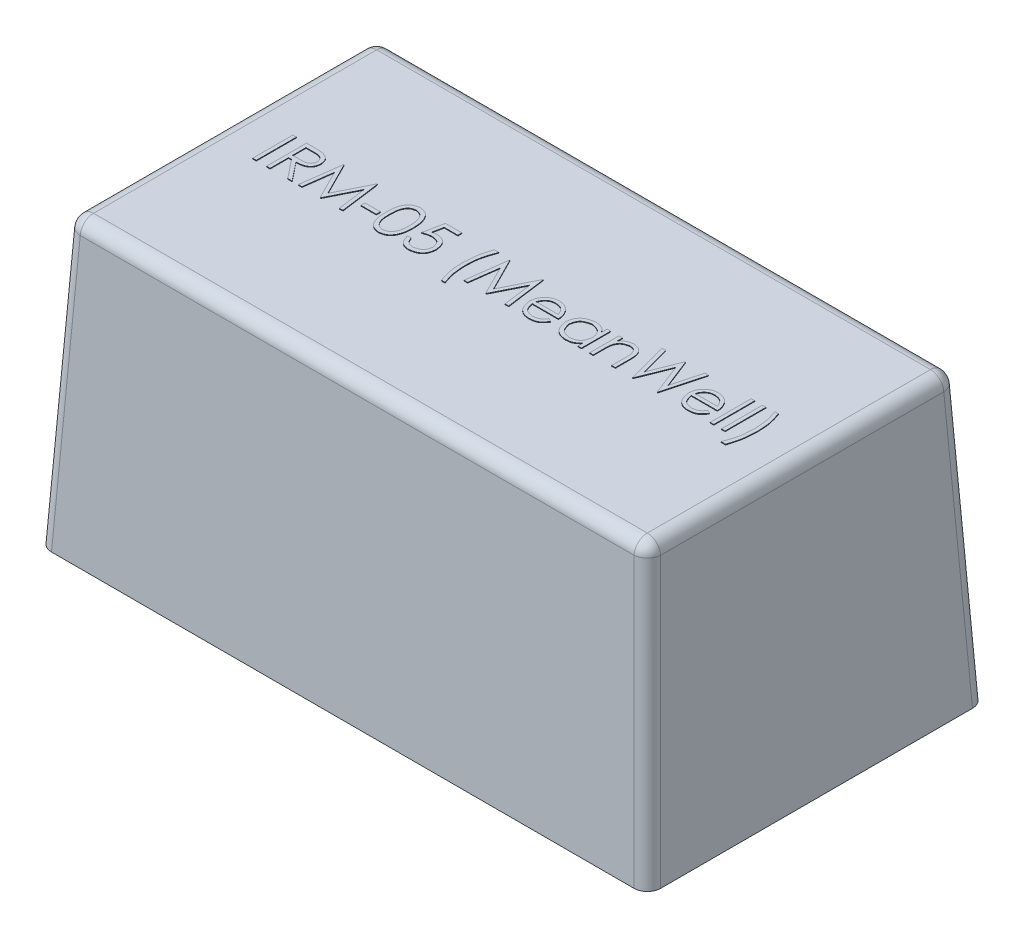
from build123d import *

# Parameters (mm, degrees)
SKIZZE1_W                       = 45.7
SKIZZE1_H                       = 25.4
AUFSATZ_LINEAR_AUSTRAGEN1_DEPTH = 21.5
FASE1_SIZE                      = 21.7
FASE1_SIZE_2                    = 1.13724881
VERRUNDUNG1_R                   = 1
VERRUNDUNG2_R                   = 1
SKIZZE2_R                       = 0.52
AUFSATZ_LINEAR_AUSTRAGEN2_DEPTH = 3.5
FASE2_SIZE                      = 0.5
WRAP_START                      = -1
WRAP_1_OUTLINE_W                = 0.269230769
WRAP_1_OUTLINE_H                = 3
WRAP_1_OUTLINE_H_2              = 3.076923077
WRAP_1_OUTLINE_W_2              = 0.26923077
WRAP_1_OUTLINE_W_3              = 1.153846154
WRAP_1_OUTLINE_H_3              = 0.307692308
WRAP_1_DEPTH                    = 1.05


with BuildPart() as part:
    # Skizze1 → Aufsatz-Linear austragen1 (new body)
    with BuildSketch(Plane(origin=(0, 0, 0), x_dir=(1, 0, 0), z_dir=(0, 1, 0))):
        with Locations((22.85, -12.7)):
            Rectangle(SKIZZE1_W, SKIZZE1_H)
    extrude(amount=AUFSATZ_LINEAR_AUSTRAGEN1_DEPTH)

    # Fase1
    # the kernel refuses this chamfer: 21.7, 1.13724881 mm, written as the material it takes off along each edge
    with BuildSketch(Plane(origin=(-56.417140399, 21.5, 0), x_dir=(0, -1, 0), z_dir=(1, 0, 0)), Plane(origin=(102.117140399, 21.5, 25.4), x_dir=(0, -1, 0), z_dir=(-1, 0, 0))) as fase1_piece_1:
        Polygon((FASE1_SIZE, 0), (0, -FASE1_SIZE_2), (0, 0), align=None)
    extrude(amount=158.534280798, mode=Mode.SUBTRACT)
    with BuildSketch(Plane(origin=(0, 21.5, 81.817140399), x_dir=(0, -1, 0), z_dir=(0, 0, -1)), Plane(origin=(45.7, 21.5, -56.417140399), x_dir=(0, -1, 0), z_dir=(0, 0, 1))) as fase1_piece_2:
        Polygon((FASE1_SIZE, 0), (0, -FASE1_SIZE_2), (0, 0), align=None)
    extrude(amount=138.234280798, mode=Mode.SUBTRACT)

    # Verrundung1
    verrundung1_edges = [part.edges().sort_by_distance(p)[0] for p in [
        (44.56275119, 21.5, 12.7),
        (22.85, 21.5, 24.26275119),
        (1.13724881, 21.5, 12.7),
        (22.85, 21.5, 1.13724881),
    ]]
    fillet(verrundung1_edges, radius=VERRUNDUNG1_R)

    # Verrundung2
    # the kernel refuses this fillet: 1 mm, written as the material it takes off along each edge
    with BuildSketch(Plane(origin=(2.086213377, 20.5, 2.086213377), x_dir=(0.036051683178571894, 0.6879070948203586, 0.7249028245467154), z_dir=(-0.5569624870263531, 0.6161051664211549, -0.5569624870263531))) as verrundung2_piece_1_section:
        Polygon((-2.008366798, -2.008366798), (2.008366798, -2.008366798), (2.008366798, 2.008366798), (-2.008366798, 2.008366798), align=None)
    verrundung2_piece_1 = extrude(amount=2.008366798, mode=Mode.PRIVATE)
    verrundung2_piece_1 = split(verrundung2_piece_1, bisect_by=Plane(origin=(2.086213377, 20.5, 2.086213377), z_dir=(0.05226442766851222, 0.9972646886363549, 0.05226442766851222)), keep=Keep.TOP, mode=Mode.PRIVATE)
    verrundung2_piece_1 = split(verrundung2_piece_1, bisect_by=Plane(origin=(2.086213377, 20.5, 2.086213377), z_dir=(-1, 0, 0)), keep=Keep.TOP, mode=Mode.PRIVATE)
    verrundung2_piece_1 = split(verrundung2_piece_1, bisect_by=Plane(origin=(2.086213377, 20.5, 2.086213377), z_dir=(0, 0, -1)), keep=Keep.TOP, mode=Mode.PRIVATE)
    verrundung2_piece_1 = split(verrundung2_piece_1, bisect_by=Plane(origin=(1.087583842, 20.552335956, 2.086213377), z_dir=(0.998629534755637, -0.052335956222659075, 0)), keep=Keep.TOP, mode=Mode.PRIVATE)
    verrundung2_piece_1 = split(verrundung2_piece_1, bisect_by=Plane(origin=(2.086213377, 20.552335956, 1.087583842), z_dir=(0, -0.052335956222659075, 0.998629534755637)), keep=Keep.TOP, mode=Mode.PRIVATE)
    verrundung2_piece_1 = split(verrundung2_piece_1, bisect_by=Plane(origin=(2.086213377, 21.5, 2.086213377), z_dir=(0, -1, 0)), keep=Keep.TOP, mode=Mode.PRIVATE)
    verrundung2_piece_1 = verrundung2_piece_1 - Plane(origin=(2.086213377, 20.5, 2.086213377), x_dir=(0.5569624870263531, -0.6161051664211549, 0.5569624870263531), z_dir=(0.036051683178571894, 0.6879070948203586, 0.7249028245467154)) * Sphere(VERRUNDUNG2_R, mode=Mode.PRIVATE)
    add(verrundung2_piece_1, mode=Mode.SUBTRACT)
    with BuildSketch(Plane(origin=(43.613786623, 20.5, 2.086213377), x_dir=(0.036051683178571894, -0.6879070948203586, -0.7249028245467154), z_dir=(0.5569624870263531, 0.6161051664211549, -0.5569624870263531))) as verrundung2_piece_2_section:
        Polygon((-2.008366798, -2.008366798), (2.008366798, -2.008366798), (2.008366798, 2.008366798), (-2.008366798, 2.008366798), align=None)
    verrundung2_piece_2 = extrude(amount=2.008366798, mode=Mode.PRIVATE)
    verrundung2_piece_2 = split(verrundung2_piece_2, bisect_by=Plane(origin=(43.613786623, 20.5, 2.086213377), z_dir=(-0.05226442766851222, 0.9972646886363549, 0.05226442766851222)), keep=Keep.TOP, mode=Mode.PRIVATE)
    verrundung2_piece_2 = split(verrundung2_piece_2, bisect_by=Plane(origin=(43.613786623, 20.5, 2.086213377), z_dir=(1, 0, 0)), keep=Keep.TOP, mode=Mode.PRIVATE)
    verrundung2_piece_2 = split(verrundung2_piece_2, bisect_by=Plane(origin=(43.613786623, 20.5, 2.086213377), z_dir=(0, 0, -1)), keep=Keep.TOP, mode=Mode.PRIVATE)
    verrundung2_piece_2 = split(verrundung2_piece_2, bisect_by=Plane(origin=(44.612416158, 20.552335956, 2.086213377), z_dir=(-0.998629534755637, -0.052335956222659075, 0)), keep=Keep.TOP, mode=Mode.PRIVATE)
    verrundung2_piece_2 = split(verrundung2_piece_2, bisect_by=Plane(origin=(43.613786623, 20.552335956, 1.087583842), z_dir=(0, -0.052335956222659075, 0.998629534755637)), keep=Keep.TOP, mode=Mode.PRIVATE)
    verrundung2_piece_2 = split(verrundung2_piece_2, bisect_by=Plane(origin=(43.613786623, 21.5, 2.086213377), z_dir=(0, -1, 0)), keep=Keep.TOP, mode=Mode.PRIVATE)
    verrundung2_piece_2 = verrundung2_piece_2 - Plane(origin=(43.613786623, 20.5, 2.086213377), x_dir=(-0.5569624870263531, -0.6161051664211549, 0.5569624870263531), z_dir=(0.036051683178571894, -0.6879070948203586, -0.7249028245467154)) * Sphere(VERRUNDUNG2_R, mode=Mode.PRIVATE)
    add(verrundung2_piece_2, mode=Mode.SUBTRACT)
    with BuildSketch(Plane(origin=(2.086213377, 20.5, 23.313786623), x_dir=(0.7249028245467154, 0.6879070948203586, -0.036051683178571894), z_dir=(-0.5569624870263531, 0.6161051664211549, 0.5569624870263531))) as verrundung2_piece_3_section:
        Polygon((-2.008366798, -2.008366798), (2.008366798, -2.008366798), (2.008366798, 2.008366798), (-2.008366798, 2.008366798), align=None)
    verrundung2_piece_3 = extrude(amount=2.008366798, mode=Mode.PRIVATE)
    verrundung2_piece_3 = split(verrundung2_piece_3, bisect_by=Plane(origin=(2.086213377, 20.5, 23.313786623), z_dir=(0.05226442766851222, 0.9972646886363549, -0.05226442766851222)), keep=Keep.TOP, mode=Mode.PRIVATE)
    verrundung2_piece_3 = split(verrundung2_piece_3, bisect_by=Plane(origin=(2.086213377, 20.5, 23.313786623), z_dir=(0, 0, 1)), keep=Keep.TOP, mode=Mode.PRIVATE)
    verrundung2_piece_3 = split(verrundung2_piece_3, bisect_by=Plane(origin=(2.086213377, 20.5, 23.313786623), z_dir=(-1, 0, 0)), keep=Keep.TOP, mode=Mode.PRIVATE)
    verrundung2_piece_3 = split(verrundung2_piece_3, bisect_by=Plane(origin=(2.086213377, 20.552335956, 24.312416158), z_dir=(0, -0.052335956222659075, -0.998629534755637)), keep=Keep.TOP, mode=Mode.PRIVATE)
    verrundung2_piece_3 = split(verrundung2_piece_3, bisect_by=Plane(origin=(1.087583842, 20.552335956, 23.313786623), z_dir=(0.998629534755637, -0.052335956222659075, 0)), keep=Keep.TOP, mode=Mode.PRIVATE)
    verrundung2_piece_3 = split(verrundung2_piece_3, bisect_by=Plane(origin=(2.086213377, 21.5, 23.313786623), z_dir=(0, -1, 0)), keep=Keep.TOP, mode=Mode.PRIVATE)
    verrundung2_piece_3 = verrundung2_piece_3 - Plane(origin=(2.086213377, 20.5, 23.313786623), x_dir=(0.5569624870263531, -0.6161051664211549, -0.5569624870263531), z_dir=(0.7249028245467154, 0.6879070948203586, -0.036051683178571894)) * Sphere(VERRUNDUNG2_R, mode=Mode.PRIVATE)
    add(verrundung2_piece_3, mode=Mode.SUBTRACT)
    with BuildSketch(Plane(origin=(43.613786623, 20.5, 23.313786623), x_dir=(0.7249028245467154, -0.6879070948203586, 0.036051683178571894), z_dir=(0.5569624870263531, 0.6161051664211549, 0.5569624870263531))) as verrundung2_piece_4_section:
        Polygon((-2.008366798, -2.008366798), (2.008366798, -2.008366798), (2.008366798, 2.008366798), (-2.008366798, 2.008366798), align=None)
    verrundung2_piece_4 = extrude(amount=2.008366798, mode=Mode.PRIVATE)
    verrundung2_piece_4 = split(verrundung2_piece_4, bisect_by=Plane(origin=(43.613786623, 20.5, 23.313786623), z_dir=(-0.05226442766851222, 0.9972646886363549, -0.05226442766851222)), keep=Keep.TOP, mode=Mode.PRIVATE)
    verrundung2_piece_4 = split(verrundung2_piece_4, bisect_by=Plane(origin=(43.613786623, 20.5, 23.313786623), z_dir=(0, 0, 1)), keep=Keep.TOP, mode=Mode.PRIVATE)
    verrundung2_piece_4 = split(verrundung2_piece_4, bisect_by=Plane(origin=(43.613786623, 20.5, 23.313786623), z_dir=(1, 0, 0)), keep=Keep.TOP, mode=Mode.PRIVATE)
    verrundung2_piece_4 = split(verrundung2_piece_4, bisect_by=Plane(origin=(43.613786623, 20.552335956, 24.312416158), z_dir=(0, -0.052335956222659075, -0.998629534755637)), keep=Keep.TOP, mode=Mode.PRIVATE)
    verrundung2_piece_4 = split(verrundung2_piece_4, bisect_by=Plane(origin=(44.612416158, 20.552335956, 23.313786623), z_dir=(-0.998629534755637, -0.052335956222659075, 0)), keep=Keep.TOP, mode=Mode.PRIVATE)
    verrundung2_piece_4 = split(verrundung2_piece_4, bisect_by=Plane(origin=(43.613786623, 21.5, 23.313786623), z_dir=(0, -1, 0)), keep=Keep.TOP, mode=Mode.PRIVATE)
    verrundung2_piece_4 = verrundung2_piece_4 - Plane(origin=(43.613786623, 20.5, 23.313786623), x_dir=(-0.5569624870263531, -0.6161051664211549, -0.5569624870263531), z_dir=(0.7249028245467154, -0.6879070948203586, 0.036051683178571894)) * Sphere(VERRUNDUNG2_R, mode=Mode.PRIVATE)
    add(verrundung2_piece_4, mode=Mode.SUBTRACT)
    with BuildSketch(Plane(origin=(1.090311669, 20.604385994, 24.309688331), x_dir=(0.9986332808396098, -0.05219280108687576, 0.0027353087984660165), z_dir=(-0.05226442766851222, -0.9972646886363549, 0.05226442766851222)), Plane(origin=(45.819822115, -2.486342148, 25.519822115), x_dir=(-0.9986332808396098, -0.05219280108687595, 0.0027353087984624638), z_dir=(-0.05226442766851222, 0.9972646886363549, -0.05226442766851222))) as verrundung2_piece_5:
        with BuildLine():
            CenterArc((VERRUNDUNG2_R * 0.997264688636, -VERRUNDUNG2_R), VERRUNDUNG2_R, 90, 89.843063666)
            Line((-VERRUNDUNG2_R * 0.00273156015282, -VERRUNDUNG2_R * 0.997260947686), (0, 0))
            Line((0, 0), (VERRUNDUNG2_R * 0.997264688636, 0))
        make_face()
    extrude(amount=23.15406171, mode=Mode.SUBTRACT)
    with BuildSketch(Plane(origin=(-0.119822115, -2.486342148, -0.119822115), x_dir=(-0.0027353087984660165, -0.05219280108687576, 0.9986332808396098), z_dir=(0.05226442766851222, 0.9972646886363549, 0.05226442766851222)), Plane(origin=(44.609688331, 20.604385994, 1.090311669), x_dir=(0.0027353087984660165, -0.05219280108687577, 0.9986332808396097), z_dir=(0.05226442766851222, -0.9972646886363549, -0.05226442766851222))) as verrundung2_piece_6:
        with BuildLine():
            CenterArc((VERRUNDUNG2_R * 0.997264688636, VERRUNDUNG2_R), VERRUNDUNG2_R, 180.156936334, 89.843063666)
            Line((-VERRUNDUNG2_R * 0.00273156015282, VERRUNDUNG2_R * 0.997260947686), (0, 0))
            Line((0, 0), (VERRUNDUNG2_R * 0.997264688636, 0))
        make_face()
    extrude(amount=23.15406171, mode=Mode.SUBTRACT)

    # Skizze2 → Aufsatz-Linear austragen2 (add)
    with BuildSketch(Plane.XZ):
        with Locations(Location((42.089518444, 3.45, 0), (0, 0, 90))):
            Circle(SKIZZE2_R)
        with Locations(Location((42.089518444, 14.2, 0), (0, 0, 90))):
            Circle(SKIZZE2_R)
        with Locations(Location((3.589518444, 3.45, 0), (0, 0, 90))):
            Circle(SKIZZE2_R)
        with Locations(Location((3.589518444, 11.45, 0), (0, 0, 90))):
            Circle(SKIZZE2_R)
    extrude(amount=AUFSATZ_LINEAR_AUSTRAGEN2_DEPTH)

    # Fase2
    fase2_edges = [part.edges().sort_by_distance(p)[0] for p in [
        (42.089518444, -3.5, 2.93),
        (42.089518444, -3.5, 13.68),
        (3.589518444, -3.5, 2.93),
        (3.589518444, -3.5, 10.93),
    ]]
    chamfer(fase2_edges, length=FASE2_SIZE)

    # Перенос1: read off the stored shape, not the designer's step
    # Перенос1 outline → Перенос1 (add)
    # profile 1 of 16: a face of its own
    with BuildSketch(Plane(origin=(0, 21.5, 0), x_dir=(1, 0, 0), z_dir=(0, 1, 0)).offset(WRAP_START)):
        with BuildLine():
            Line((7.488737364, -13.822017498), (6.386573903, -12.437402113))
            add(Edge.make_bspline(
                [(6.386573903, -12.437402113), (6.613405611, -12.42842299), (6.983870512, -12.413758152), (7.395589942, -12.053417943), (7.432032264, -11.767457266), (7.450275826, -11.624301152)],
                knots=[0, 0, 0, 0, 0.440919364, 0.720116024, 1, 1, 1, 1], degree=3))
            add(Edge.make_bspline(
                [(7.450275826, -11.624301152), (7.427387007, -11.463914345), (7.375626804, -11.101219631), (7.035453937, -10.948223033), (6.845708518, -10.862882883)],
                knots=[0, 0, 0, 0, 0.442208835, 1, 1, 1, 1], degree=3))
            add(Edge.make_bspline(
                [(6.845708518, -10.862882883), (6.746523027, -10.85005188), (6.520978605, -10.820874617), (6.293476642, -10.82160712), (6.166021018, -10.822017498)],
                knots=[0, 0, 0, 0, 0.439760335, 1, 1, 1, 1], degree=3))
            Line((6.166021018, -10.822017498), (5.565660441, -10.822017498))
            Line((5.565660441, -10.822017498), (5.565660441, -13.822017498))
            Line((5.565660441, -13.822017498), (5.83489121, -13.822017498))
            Line((5.83489121, -13.822017498), (5.83489121, -12.437402113))
            Line((5.83489121, -12.437402113), (6.05364121, -12.437402113))
            Line((6.05364121, -12.437402113), (7.155804672, -13.822017498))
            Line((7.155804672, -13.822017498), (7.488737364, -13.822017498))
        make_face()
        with BuildLine():
            Line((5.83489121, -11.129709806), (6.39739121, -11.129709806))
            add(Edge.make_bspline(
                [(6.39739121, -11.129709806), (6.577424202, -11.126254917), (6.847092878, -11.121079893), (7.135941686, -11.361160469), (7.166020269, -11.536243234), (7.181045056, -11.62370019)],
                knots=[0, 0, 0, 0, 0.501300847, 0.7508909, 1, 1, 1, 1], degree=3))
            add(Edge.make_bspline(
                [(7.181045056, -11.62370019), (7.166915768, -11.713555527), (7.138658254, -11.893259448), (6.841549979, -12.136214373), (6.56728911, -12.134836511), (6.384170056, -12.133916536)],
                knots=[0, 0, 0, 0, 0.249442492, 0.498866239, 1, 1, 1, 1], degree=3))
            Line((6.384170056, -12.133916536), (5.83489121, -12.129709806))
            Line((5.83489121, -12.129709806), (5.83489121, -11.129709806))
        make_face(mode=Mode.SUBTRACT)
    # profile 2 of 16: a face of its own
    with BuildSketch(Plane(origin=(0, 21.5, 0), x_dir=(1, 0, 0), z_dir=(0, 1, 0)).offset(WRAP_START)):
        with BuildLine():
            add(Edge.make_bspline(
                [(14.03020371, -10.745094421), (13.854574445, -10.77607514), (13.502635397, -10.838156621), (13.165397112, -11.286221213), (13.039672279, -11.79727875), (13.031361611, -12.147698582), (13.027198903, -12.323219421)],
                knots=[0, 0, 0, 0, 0.24817273, 0.497307066, 0.7482075, 1, 1, 1, 1], degree=3))
            add(Edge.make_bspline(
                [(13.027198903, -12.323219421), (13.031570647, -12.498545057), (13.040298697, -12.84857719), (13.168241028, -13.357836046), (13.502528252, -13.807350136), (13.854536795, -13.868449466), (14.03020371, -13.898940575)],
                knots=[0, 0, 0, 0, 0.251778203, 0.502667285, 0.751810273, 1, 1, 1, 1], degree=3))
            add(Edge.make_bspline(
                [(14.03020371, -13.898940575), (14.206994907, -13.868244146), (14.561210294, -13.806741382), (14.904772978, -13.362009947), (15.051194112, -12.852878617), (15.060832779, -12.499975781), (15.065660441, -12.323219421)],
                knots=[0, 0, 0, 0, 0.248282854, 0.497454672, 0.74829309, 1, 1, 1, 1], degree=3))
            add(Edge.make_bspline(
                [(15.065660441, -12.323219421), (15.060715348, -12.14626212), (15.050841573, -11.792934782), (14.90409689, -11.283674408), (14.562396623, -10.836287597), (14.207364452, -10.775451553), (14.03020371, -10.745094421)],
                knots=[0, 0, 0, 0, 0.251688421, 0.502541567, 0.751768679, 1, 1, 1, 1], degree=3))
        make_face()
        with BuildLine():
            add(Edge.make_bspline(
                [(13.296429672, -12.322017498), (13.299309477, -12.044885222), (13.303621475, -11.629928702), (13.62766301, -11.139777668), (13.902256834, -11.081736416), (14.039218133, -11.052786729)],
                knots=[0, 0, 0, 0, 0.501952468, 0.751584954, 1, 1, 1, 1], degree=3))
            add(Edge.make_bspline(
                [(14.039218133, -11.052786729), (14.176214005, -11.082241506), (14.45097018, -11.141315417), (14.767437132, -11.634647317), (14.784822566, -12.046830217), (14.796429672, -12.322017498)],
                knots=[0, 0, 0, 0, 0.248415166, 0.49821648, 1, 1, 1, 1], degree=3))
            add(Edge.make_bspline(
                [(14.796429672, -12.322017498), (14.794266062, -12.434772352), (14.789353247, -12.690799928), (14.721063052, -12.937930346), (14.682847941, -13.076224229)],
                knots=[0, 0, 0, 0, 0.440401208, 1, 1, 1, 1], degree=3))
            add(Edge.make_bspline(
                [(14.682847941, -13.076224229), (14.62815456, -13.199386906), (14.504906186, -13.476926883), (14.205665896, -13.55038714), (14.039218133, -13.591248267)],
                knots=[0, 0, 0, 0, 0.443765538, 1, 1, 1, 1], degree=3))
            add(Edge.make_bspline(
                [(14.039218133, -13.591248267), (13.902366267, -13.562051944), (13.628032145, -13.503524808), (13.303160954, -13.01426793), (13.299125096, -12.599217056), (13.296429672, -12.322017498)],
                knots=[0, 0, 0, 0, 0.248463989, 0.498072495, 1, 1, 1, 1], degree=3))
        make_face(mode=Mode.SUBTRACT)
    # profile 3 of 16: a face of its own
    with BuildSketch(Plane(origin=(0, 21.5, 0), x_dir=(1, 0, 0), z_dir=(0, 1, 0)).offset(WRAP_START)):
        with BuildLine():
            add(Edge.make_bspline(
                [(16.342102749, -12.168171344), (16.514067607, -12.189179717), (16.899542487, -12.236271898), (17.006447182, -12.618641124), (17.065660441, -12.83043096)],
                knots=[0, 0, 0, 0, 0.446111712, 1, 1, 1, 1], degree=3))
            add(Edge.make_bspline(
                [(17.065660441, -12.83043096), (17.030336171, -13.012721162), (16.950550598, -13.424453051), (16.535521347, -13.531561191), (16.304242172, -13.591248267)],
                knots=[0, 0, 0, 0, 0.442740062, 1, 1, 1, 1], degree=3))
            add(Edge.make_bspline(
                [(16.304242172, -13.591248267), (16.162602956, -13.570040407), (15.843656729, -13.522284093), (15.714425246, -13.220534096), (15.642583518, -13.052786729)],
                knots=[0, 0, 0, 0, 0.444084941, 1, 1, 1, 1], degree=3))
            Line((15.642583518, -13.052786729), (15.373352749, -13.052786729))
            add(Edge.make_bspline(
                [(15.373352749, -13.052786729), (15.429160305, -13.248471129), (15.520731645, -13.569558167), (15.905118012, -13.858840425), (16.160749076, -13.885570194), (16.288617172, -13.898940575)],
                knots=[0, 0, 0, 0, 0.438171803, 0.718970375, 1, 1, 1, 1], degree=3))
            add(Edge.make_bspline(
                [(16.288617172, -13.898940575), (16.53510865, -13.856111029), (16.940370777, -13.785694018), (17.281917991, -13.305211825), (17.317223847, -12.996387606), (17.33489121, -12.841849229)],
                knots=[0, 0, 0, 0, 0.43681497, 0.718177218, 1, 1, 1, 1], degree=3))
            add(Edge.make_bspline(
                [(17.33489121, -12.841849229), (17.298094972, -12.617206779), (17.237648445, -12.248178402), (16.818046059, -11.906574924), (16.533262001, -11.875850758), (16.390780633, -11.860479036)],
                knots=[0, 0, 0, 0, 0.437391695, 0.718519354, 1, 1, 1, 1], degree=3))
            add(Edge.make_bspline(
                [(16.390780633, -11.860479036), (16.338034762, -11.86308532), (16.218140293, -11.869009555), (16.102295672, -11.900907442), (16.037415249, -11.918772306)],
                knots=[0, 0, 0, 0, 0.439935812, 1, 1, 1, 1], degree=3))
            Line((16.037415249, -11.918772306), (16.199073903, -11.129709806))
            Line((16.199073903, -11.129709806), (17.219506595, -11.129709806))
            Line((17.219506595, -11.129709806), (17.219506595, -10.822017498))
            Line((17.219506595, -10.822017498), (15.988737364, -10.822017498))
            Line((15.988737364, -10.822017498), (15.681045056, -12.322017498))
            add(Edge.make_bspline(
                [(15.681045056, -12.322017498), (15.774904172, -12.28619293), (15.987937666, -12.204881349), (16.215051564, -12.181340484), (16.342102749, -12.168171344)],
                knots=[0, 0, 0, 0, 0.440583842, 1, 1, 1, 1], degree=3))
        make_face()
    # profile 4 of 16: a face of its own
    with BuildSketch(Plane(origin=(0, 21.5, 0), x_dir=(1, 0, 0), z_dir=(0, 1, 0)).offset(WRAP_START)):
        with BuildLine():
            add(Edge.make_bspline(
                [(19.796429672, -14.668171344), (19.703047654, -14.398150182), (19.490790402, -13.784392301), (19.464820396, -13.134377377), (19.450275826, -12.770334806)],
                knots=[0, 0, 0, 0, 0.439947364, 1, 1, 1, 1], degree=3))
            add(Edge.make_bspline(
                [(19.450275826, -12.770334806), (19.46260633, -12.457812972), (19.490603542, -11.748211811), (19.736021514, -11.080353631), (19.873352749, -10.706632883)],
                knots=[0, 0, 0, 0, 0.440419, 1, 1, 1, 1], degree=3))
            Line((19.873352749, -10.706632883), (19.527198903, -10.706632883))
            add(Edge.make_bspline(
                [(19.527198903, -10.706632883), (19.434391576, -11.007581048), (19.223470798, -11.691538057), (19.196274629, -12.40773402), (19.181045056, -12.808796344)],
                knots=[0, 0, 0, 0, 0.440010353, 1, 1, 1, 1], degree=3))
            add(Edge.make_bspline(
                [(19.181045056, -12.808796344), (19.190170568, -13.089032837), (19.210890049, -13.725309982), (19.413708234, -14.329875513), (19.527198903, -14.668171344)],
                knots=[0, 0, 0, 0, 0.440431493, 1, 1, 1, 1], degree=3))
            Line((19.527198903, -14.668171344), (19.796429672, -14.668171344))
        make_face()
    # profile 5 of 16: a face of its own
    with BuildSketch(Plane(origin=(0, 21.5, 0), x_dir=(1, 0, 0), z_dir=(0, 1, 0)).offset(WRAP_START)):
        with BuildLine():
            add(Edge.make_bspline(
                [(26.411814287, -12.78355596), (26.405452756, -12.663288777), (26.39103089, -12.390637868), (26.251317773, -12.154638146), (26.173232556, -12.022738652)],
                knots=[0, 0, 0, 0, 0.441103179, 1, 1, 1, 1], degree=3))
            add(Edge.make_bspline(
                [(26.173232556, -12.022738652), (26.069377575, -11.909926959), (25.833922121, -11.654165242), (25.48528172, -11.613805875), (25.290420056, -11.591248267)],
                knots=[0, 0, 0, 0, 0.44108123, 1, 1, 1, 1], degree=3))
            add(Edge.make_bspline(
                [(25.290420056, -11.591248267), (25.143003869, -11.603196971), (24.809046861, -11.630265596), (24.568059169, -11.867428364), (24.433448903, -11.999902113)],
                knots=[0, 0, 0, 0, 0.441422652, 1, 1, 1, 1], degree=3))
            add(Edge.make_bspline(
                [(24.433448903, -11.999902113), (24.367621142, -12.096814414), (24.218207126, -12.316783252), (24.194376535, -12.582964342), (24.181045056, -12.731873267)],
                knots=[0, 0, 0, 0, 0.440572864, 1, 1, 1, 1], degree=3))
            add(Edge.make_bspline(
                [(24.181045056, -12.731873267), (24.229888351, -12.989113992), (24.310045451, -13.411273694), (24.787398571, -13.814799846), (25.118159315, -13.845236089), (25.283809479, -13.860479036)],
                knots=[0, 0, 0, 0, 0.437768897, 0.718425852, 1, 1, 1, 1], degree=3))
            add(Edge.make_bspline(
                [(25.283809479, -13.860479036), (25.471750097, -13.84172306), (25.897150694, -13.799269205), (26.153393894, -13.450175818), (26.296429672, -13.255310767)],
                knots=[0, 0, 0, 0, 0.441796788, 1, 1, 1, 1], degree=3))
            Line((26.296429672, -13.255310767), (26.057246979, -13.129709806))
            add(Edge.make_bspline(
                [(26.057246979, -13.129709806), (25.970063918, -13.248836566), (25.772565927, -13.518697425), (25.437378622, -13.565247276), (25.250155633, -13.591248267)],
                knots=[0, 0, 0, 0, 0.44143771, 1, 1, 1, 1], degree=3))
            add(Edge.make_bspline(
                [(25.250155633, -13.591248267), (25.057185222, -13.553966509), (24.621163096, -13.469727318), (24.511439195, -13.029147993), (24.450275826, -12.78355596)],
                knots=[0, 0, 0, 0, 0.442570228, 1, 1, 1, 1], degree=3))
            Line((24.450275826, -12.78355596), (26.411814287, -12.78355596))
        make_face()
        with BuildLine():
            Line((26.142583518, -12.51432519), (24.478521018, -12.51432519))
            add(Edge.make_bspline(
                [(24.478521018, -12.51432519), (24.502488526, -12.440331319), (24.556811405, -12.272622601), (24.673906266, -12.140074911), (24.739338326, -12.066007883)],
                knots=[0, 0, 0, 0, 0.441204682, 1, 1, 1, 1], degree=3))
            add(Edge.make_bspline(
                [(24.739338326, -12.066007883), (24.812928872, -12.011772513), (24.97997442, -11.888661904), (25.187910581, -11.870589687), (25.304242172, -11.860479036)],
                knots=[0, 0, 0, 0, 0.440541801, 1, 1, 1, 1], degree=3))
            add(Edge.make_bspline(
                [(25.304242172, -11.860479036), (25.479926761, -11.885045558), (25.875834114, -11.940406513), (26.047239548, -12.309190018), (26.142583518, -12.51432519)],
                knots=[0, 0, 0, 0, 0.443751771, 1, 1, 1, 1], degree=3))
        make_face(mode=Mode.SUBTRACT)
    # profile 6 of 16: a face of its own
    with BuildSketch(Plane(origin=(0, 21.5, 0), x_dir=(1, 0, 0), z_dir=(0, 1, 0)).offset(WRAP_START)):
        with BuildLine():
            add(Edge.make_bspline(
                [(28.024795056, -11.591248267), (27.764112971, -11.643618003), (27.335360804, -11.729752184), (26.936923932, -12.219706299), (26.894533894, -12.55321089), (26.873352749, -12.719854036)],
                knots=[0, 0, 0, 0, 0.436944434, 0.718656493, 1, 1, 1, 1], degree=3))
            add(Edge.make_bspline(
                [(26.873352749, -12.719854036), (26.926960976, -12.981361877), (27.015169719, -13.411655497), (27.515020577, -13.800271646), (27.84929835, -13.840414361), (28.016381595, -13.860479036)],
                knots=[0, 0, 0, 0, 0.436598036, 0.718392797, 1, 1, 1, 1], degree=3))
            add(Edge.make_bspline(
                [(28.016381595, -13.860479036), (28.169208625, -13.847810507), (28.515569237, -13.819099096), (28.769774004, -13.577697249), (28.911814287, -13.442810767)],
                knots=[0, 0, 0, 0, 0.441236747, 1, 1, 1, 1], degree=3))
            Line((28.911814287, -13.442810767), (28.911814287, -13.822017498))
            Line((28.911814287, -13.822017498), (29.181045056, -13.822017498))
            Line((29.181045056, -13.822017498), (29.181045056, -11.629709806))
            Line((29.181045056, -11.629709806), (28.911814287, -11.629709806))
            Line((28.911814287, -11.629709806), (28.911814287, -12.035358844))
            add(Edge.make_bspline(
                [(28.911814287, -12.035358844), (28.809223035, -11.918570584), (28.576557027, -11.653707275), (28.22265069, -11.613645365), (28.024795056, -11.591248267)],
                knots=[0, 0, 0, 0, 0.440937859, 1, 1, 1, 1], degree=3))
        make_face()
        with BuildLine():
            add(Edge.make_bspline(
                [(28.028400826, -11.860479036), (28.230646291, -11.898677884), (28.563176996, -11.961484186), (28.868036639, -12.343720914), (28.897219823, -12.601670948), (28.911814287, -12.730671344)],
                knots=[0, 0, 0, 0, 0.436940555, 0.718414878, 1, 1, 1, 1], degree=3))
            add(Edge.make_bspline(
                [(28.911814287, -12.730671344), (28.872370142, -12.933373778), (28.807478254, -13.26685149), (28.408484739, -13.544328298), (28.153532053, -13.575603475), (28.025996979, -13.591248267)],
                knots=[0, 0, 0, 0, 0.436507279, 0.718123835, 1, 1, 1, 1], degree=3))
            add(Edge.make_bspline(
                [(28.025996979, -13.591248267), (27.817326194, -13.550334025), (27.346433578, -13.458005745), (27.215497012, -12.985807647), (27.142583518, -12.722858844)],
                knots=[0, 0, 0, 0, 0.443138792, 1, 1, 1, 1], degree=3))
            add(Edge.make_bspline(
                [(27.142583518, -12.722858844), (27.186846977, -12.514807748), (27.286806057, -12.044971087), (27.763046933, -11.926493099), (28.028400826, -11.860479036)],
                knots=[0, 0, 0, 0, 0.4428158, 1, 1, 1, 1], degree=3))
        make_face(mode=Mode.SUBTRACT)
    # profile 7 of 16: a face of its own
    with BuildSketch(Plane(origin=(0, 21.5, 0), x_dir=(1, 0, 0), z_dir=(0, 1, 0)).offset(WRAP_START)):
        with BuildLine():
            add(Edge.make_bspline(
                [(30.065660441, -13.029349229), (30.065555755, -12.942589756), (30.065318017, -12.745562471), (30.092124395, -12.550292308), (30.107126787, -12.441007883)],
                knots=[0, 0, 0, 0, 0.440342428, 1, 1, 1, 1], degree=3))
            add(Edge.make_bspline(
                [(30.107126787, -12.441007883), (30.170600436, -12.300062971), (30.314019158, -11.981597919), (30.660039775, -11.903829204), (30.852920056, -11.860479036)],
                knots=[0, 0, 0, 0, 0.442575755, 1, 1, 1, 1], degree=3))
            add(Edge.make_bspline(
                [(30.852920056, -11.860479036), (30.973156039, -11.871838582), (31.243956253, -11.897422998), (31.356082793, -12.150987951), (31.418424864, -12.291969421)],
                knots=[0, 0, 0, 0, 0.444002539, 1, 1, 1, 1], degree=3))
            add(Edge.make_bspline(
                [(31.418424864, -12.291969421), (31.428646919, -12.364696806), (31.451892309, -12.530081997), (31.450856271, -12.697160825), (31.450275826, -12.790767498)],
                knots=[0, 0, 0, 0, 0.439745452, 1, 1, 1, 1], degree=3))
            Line((31.450275826, -12.790767498), (31.450275826, -13.822017498))
            Line((31.450275826, -13.822017498), (31.719506595, -13.822017498))
            Line((31.719506595, -13.822017498), (31.719506595, -12.702426152))
            add(Edge.make_bspline(
                [(31.719506595, -12.702426152), (31.718175328, -12.466117492), (31.716002155, -12.080364958), (31.342653797, -11.652445772), (31.047513029, -11.611661032), (30.899795056, -11.591248267)],
                knots=[0, 0, 0, 0, 0.44128961, 0.720365415, 1, 1, 1, 1], degree=3))
            add(Edge.make_bspline(
                [(30.899795056, -11.591248267), (30.753722458, -11.606373634), (30.422386442, -11.640682456), (30.193589885, -11.887267044), (30.065660441, -12.025142498)],
                knots=[0, 0, 0, 0, 0.440859402, 1, 1, 1, 1], degree=3))
            Line((30.065660441, -12.025142498), (30.065660441, -11.629709806))
            Line((30.065660441, -11.629709806), (29.796429672, -11.629709806))
            Line((29.796429672, -11.629709806), (29.796429672, -13.822017498))
            Line((29.796429672, -13.822017498), (30.065660441, -13.822017498))
            Line((30.065660441, -13.822017498), (30.065660441, -13.029349229))
        make_face()
    # profile 8 of 16: a face of its own
    with BuildSketch(Plane(origin=(0, 21.5, 0), x_dir=(1, 0, 0), z_dir=(0, 1, 0)).offset(WRAP_START)):
        with BuildLine():
            add(Edge.make_bspline(
                [(38.33489121, -12.78355596), (38.328529679, -12.663288777), (38.314107813, -12.390637868), (38.174394696, -12.154638146), (38.096309479, -12.022738652)],
                knots=[0, 0, 0, 0, 0.441103179, 1, 1, 1, 1], degree=3))
            add(Edge.make_bspline(
                [(38.096309479, -12.022738652), (37.992454498, -11.909926959), (37.756999044, -11.654165242), (37.408358644, -11.613805875), (37.213496979, -11.591248267)],
                knots=[0, 0, 0, 0, 0.44108123, 1, 1, 1, 1], degree=3))
            add(Edge.make_bspline(
                [(37.213496979, -11.591248267), (37.066080792, -11.603196971), (36.732123784, -11.630265596), (36.491136092, -11.867428364), (36.356525826, -11.999902113)],
                knots=[0, 0, 0, 0, 0.441422652, 1, 1, 1, 1], degree=3))
            add(Edge.make_bspline(
                [(36.356525826, -11.999902113), (36.290698065, -12.096814414), (36.141284049, -12.316783252), (36.117453458, -12.582964342), (36.104121979, -12.731873267)],
                knots=[0, 0, 0, 0, 0.440572864, 1, 1, 1, 1], degree=3))
            add(Edge.make_bspline(
                [(36.104121979, -12.731873267), (36.152965274, -12.989113992), (36.233122374, -13.411273694), (36.710475494, -13.814799846), (37.041236238, -13.845236089), (37.206886403, -13.860479036)],
                knots=[0, 0, 0, 0, 0.437768897, 0.718425852, 1, 1, 1, 1], degree=3))
            add(Edge.make_bspline(
                [(37.206886403, -13.860479036), (37.39482702, -13.84172306), (37.820227617, -13.799269205), (38.076470817, -13.450175818), (38.219506595, -13.255310767)],
                knots=[0, 0, 0, 0, 0.441796788, 1, 1, 1, 1], degree=3))
            Line((38.219506595, -13.255310767), (37.980323903, -13.129709806))
            add(Edge.make_bspline(
                [(37.980323903, -13.129709806), (37.893140841, -13.248836566), (37.69564285, -13.518697425), (37.360455545, -13.565247276), (37.173232556, -13.591248267)],
                knots=[0, 0, 0, 0, 0.44143771, 1, 1, 1, 1], degree=3))
            add(Edge.make_bspline(
                [(37.173232556, -13.591248267), (36.980262145, -13.553966509), (36.544240019, -13.469727318), (36.434516118, -13.029147993), (36.373352749, -12.78355596)],
                knots=[0, 0, 0, 0, 0.442570228, 1, 1, 1, 1], degree=3))
            Line((36.373352749, -12.78355596), (38.33489121, -12.78355596))
        make_face()
        with BuildLine():
            Line((38.065660441, -12.51432519), (36.401597941, -12.51432519))
            add(Edge.make_bspline(
                [(36.401597941, -12.51432519), (36.425565449, -12.440331319), (36.479888328, -12.272622601), (36.596983189, -12.140074911), (36.662415249, -12.066007883)],
                knots=[0, 0, 0, 0, 0.441204682, 1, 1, 1, 1], degree=3))
            add(Edge.make_bspline(
                [(36.662415249, -12.066007883), (36.736005795, -12.011772513), (36.903051343, -11.888661904), (37.110987504, -11.870589687), (37.227319095, -11.860479036)],
                knots=[0, 0, 0, 0, 0.440541801, 1, 1, 1, 1], degree=3))
            add(Edge.make_bspline(
                [(37.227319095, -11.860479036), (37.403003684, -11.885045558), (37.798911037, -11.940406513), (37.970316472, -12.309190018), (38.065660441, -12.51432519)],
                knots=[0, 0, 0, 0, 0.443751771, 1, 1, 1, 1], degree=3))
        make_face(mode=Mode.SUBTRACT)
    # profile 9 of 16: a face of its own
    with BuildSketch(Plane(origin=(0, 21.5, 0), x_dir=(1, 0, 0), z_dir=(0, 1, 0)).offset(WRAP_START)):
        with BuildLine():
            add(Edge.make_bspline(
                [(40.565660441, -10.706632883), (40.658757311, -10.976710941), (40.870367927, -11.590602513), (40.896935157, -12.240493966), (40.911814287, -12.604469421)],
                knots=[0, 0, 0, 0, 0.439944235, 1, 1, 1, 1], degree=3))
            add(Edge.make_bspline(
                [(40.911814287, -12.604469421), (40.899860196, -12.917087909), (40.872720143, -13.626843418), (40.626504828, -14.294557954), (40.488737364, -14.668171344)],
                knots=[0, 0, 0, 0, 0.440459402, 1, 1, 1, 1], degree=3))
            Line((40.488737364, -14.668171344), (40.83489121, -14.668171344))
            add(Edge.make_bspline(
                [(40.83489121, -14.668171344), (40.927289675, -14.367506192), (41.137280062, -13.684196232), (41.165334776, -12.968943871), (41.181045056, -12.568411729)],
                knots=[0, 0, 0, 0, 0.440012835, 1, 1, 1, 1], degree=3))
            add(Edge.make_bspline(
                [(41.181045056, -12.568411729), (41.172099607, -12.287771988), (41.151791128, -11.650647346), (40.948587819, -11.045324177), (40.83489121, -10.706632883)],
                knots=[0, 0, 0, 0, 0.440478554, 1, 1, 1, 1], degree=3))
            Line((40.83489121, -10.706632883), (40.565660441, -10.706632883))
        make_face()
    # profile 10 of 16: a face of its own
    with BuildSketch(Plane(origin=(0, 21.5, 0), x_dir=(1, 0, 0), z_dir=(0, 1, 0)).offset(WRAP_START)):
        with Locations((4.661814288, -12.322017498)):
            Rectangle(WRAP_1_OUTLINE_W, WRAP_1_OUTLINE_H)
    # profile 11 of 16: a face of its own
    with BuildSketch(Plane(origin=(0, 21.5, 0), x_dir=(1, 0, 0), z_dir=(0, 1, 0)).offset(WRAP_START)):
        Polygon((10.738737364, -11.663363652), (11.025996979, -13.822017498), (11.296429672, -13.822017498), (10.897992172, -10.822017498), (10.858929672, -10.822017498), (9.623352749, -13.28355596), (8.384771018, -10.822017498), (8.346309479, -10.822017498), (7.950275826, -13.822017498), (8.221309479, -13.822017498), (8.507968133, -11.65855596), (9.595107556, -13.822017498), (9.655804672, -13.822017498), align=None)
    # profile 12 of 16: a face of its own
    with BuildSketch(Plane(origin=(0, 21.5, 0), x_dir=(1, 0, 0), z_dir=(0, 1, 0)).offset(WRAP_START)):
        Polygon((23.161814287, -11.663363652), (23.449073903, -13.822017498), (23.719506595, -13.822017498), (23.321069095, -10.822017498), (23.282006595, -10.822017498), (22.046429672, -13.28355596), (20.807847941, -10.822017498), (20.769386403, -10.822017498), (20.373352749, -13.822017498), (20.644386403, -13.822017498), (20.931045056, -11.65855596), (22.018184479, -13.822017498), (22.078881595, -13.822017498), align=None)
    # profile 13 of 16: a face of its own
    with BuildSketch(Plane(origin=(0, 21.5, 0), x_dir=(1, 0, 0), z_dir=(0, 1, 0)).offset(WRAP_START)):
        Polygon((33.969506595, -11.527546344), (34.872150826, -13.822017498), (34.910612364, -13.822017498), (35.719506595, -10.822017498), (35.44426621, -10.822017498), (34.854121979, -13.007113652), (33.997150826, -10.822017498), (33.958088326, -10.822017498), (33.08489121, -13.02213769), (32.497751787, -10.822017498), (32.219506595, -10.822017498), (33.017583518, -13.822017498), (33.056045056, -13.822017498), align=None)
    # profile 14 of 16: a face of its own
    with BuildSketch(Plane(origin=(0, 21.5, 0), x_dir=(1, 0, 0), z_dir=(0, 1, 0)).offset(WRAP_START)):
        with Locations((38.969506595, -12.28355596)):
            Rectangle(WRAP_1_OUTLINE_W, WRAP_1_OUTLINE_H_2)
    # profile 15 of 16: a face of its own
    with BuildSketch(Plane(origin=(0, 21.5, 0), x_dir=(1, 0, 0), z_dir=(0, 1, 0)).offset(WRAP_START)):
        with Locations((39.815660441, -12.28355596)):
            Rectangle(WRAP_1_OUTLINE_W_2, WRAP_1_OUTLINE_H_2)
    # profile 16 of 16: a face of its own
    with BuildSketch(Plane(origin=(0, 21.5, 0), x_dir=(1, 0, 0), z_dir=(0, 1, 0)).offset(WRAP_START)):
        with Locations((12.219506595, -12.668171344)):
            Rectangle(WRAP_1_OUTLINE_W_3, WRAP_1_OUTLINE_H_3)
    extrude(amount=WRAP_1_DEPTH)


solid = part.part
